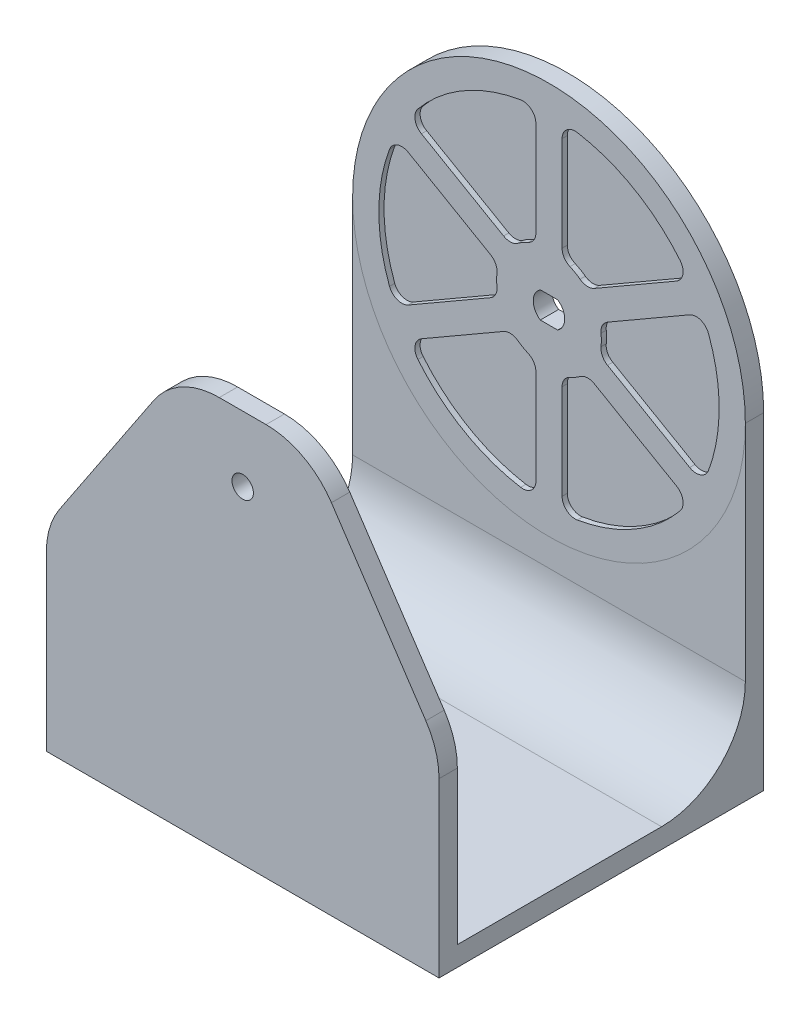
from build123d import *

# Parameters (mm, degrees)
SKETCH2_R           = 75
BOSS_EXTRUDE1_DEPTH = 3.5
CUT_EXTRUDE2_DEPTH  = 2
BOSS_EXTRUDE2_DEPTH = 7
SKETCH11_W          = 150
SKETCH11_H          = 7.544328289
BOSS_EXTRUDE4_DEPTH = 110
SKETCH12_W          = 150
SKETCH12_H          = 150.044328289
BOSS_EXTRUDE5_DEPTH = 7
SKETCH13_R          = 4.1
CUT_EXTRUDE3_DEPTH  = 7
FILLET1_R           = 32
CUT_EXTRUDE4_DEPTH  = 7
CUT_EXTRUDE5_DEPTH  = 7
FILLET2_R           = 30
FILLET3_R           = 30
FILLET4_R           = 30
FILLET5_R           = 30


with BuildPart() as part:
    # Sketch2 → Boss-Extrude1 (new, symmetric)
    with BuildSketch(Plane.XY):
        Circle(SKETCH2_R)
        with BuildLine():
            Line((-3.31662479, 5), (3.31662479, 5))
            ThreePointArc((3.31662479, 5), (6, 0), (3.31662479, -5))
            Line((3.31662479, -5), (-3.31662479, -5))
            ThreePointArc((-3.31662479, -5), (-6, 0), (-3.31662479, 5))
        make_face(mode=Mode.SUBTRACT)
    extrude(amount=BOSS_EXTRUDE1_DEPTH, both=True)

    # Sketch7 → Cut-Extrude2 (cut)
    with BuildSketch(Plane(origin=(0, 0, -3.5), x_dir=(-1, 0, 0), z_dir=(0, 0, -1))):
        with BuildLine():
            Line((-5, 59.160797831), (-5, 22.912878475))
            ThreePointArc((-5, 22.912878475), (-5.816699867, 20.174265687), (-8, 18.33030278))
            ThreePointArc((-8, 18.33030278), (-10, 17.320508076), (-11.874507866, 16.09335462))
            ThreePointArc((-11.874507866, 16.09335462), (-14.563076654, 15.124542695), (-17.343134833, 15.786566256))
            Line((-17.343134833, 15.786566256), (-48.73475383, 33.910525934))
            ThreePointArc((-48.73475383, 33.910525934), (-51.15568603, 37.354974521), (-50.087649982, 41.427374033))
            ThreePointArc((-50.087649982, 41.427374033), (-32.5, 56.291651246), (-10.833333333, 64.090864317))
            ThreePointArc((-10.833333333, 64.090864317), (-6.772513878, 62.97961091), (-5, 59.160797831))
        make_face()
        with BuildLine():
            Line((5, 59.160797831), (5, 22.912878475))
            ThreePointArc((5, 22.912878475), (5.816699867, 20.174265687), (8, 18.33030278))
            ThreePointArc((8, 18.33030278), (10, 17.320508076), (11.874507866, 16.09335462))
            ThreePointArc((11.874507866, 16.09335462), (14.563076654, 15.124542695), (17.343134833, 15.786566256))
            Line((17.343134833, 15.786566256), (48.73475383, 33.910525934))
            ThreePointArc((48.73475383, 33.910525934), (51.15568603, 37.354974521), (50.087649982, 41.427374033))
            ThreePointArc((50.087649982, 41.427374033), (32.5, 56.291651246), (10.833333333, 64.090864317))
            ThreePointArc((10.833333333, 64.090864317), (6.772513878, 62.97961091), (5, 59.160797831))
        make_face()
        with BuildLine():
            Line((53.73475383, 25.250271897), (22.343134833, 7.126312218))
            ThreePointArc((22.343134833, 7.126312218), (20.379776522, 5.049722992), (19.874507866, 2.23694816))
            ThreePointArc((19.874507866, 2.23694816), (20, 0), (19.874507866, -2.23694816))
            ThreePointArc((19.874507866, -2.23694816), (20.379776522, -5.049722992), (22.343134833, -7.126312218))
            Line((22.343134833, -7.126312218), (53.73475383, -25.250271897))
            ThreePointArc((53.73475383, -25.250271897), (57.928199908, -25.624636389), (60.920983316, -22.663490284))
            ThreePointArc((60.920983316, -22.663490284), (65, 0), (60.920983316, 22.663490284))
            ThreePointArc((60.920983316, 22.663490284), (57.928199908, 25.624636389), (53.73475383, 25.250271897))
        make_face()
        with BuildLine():
            Line((48.73475383, -33.910525934), (17.343134833, -15.786566256))
            ThreePointArc((17.343134833, -15.786566256), (14.563076654, -15.124542695), (11.874507866, -16.09335462))
            ThreePointArc((11.874507866, -16.09335462), (10, -17.320508076), (8, -18.33030278))
            ThreePointArc((8, -18.33030278), (5.816699867, -20.174265687), (5, -22.912878475))
            Line((5, -22.912878475), (5, -59.160797831))
            ThreePointArc((5, -59.160797831), (6.772513878, -62.97961091), (10.833333333, -64.090864317))
            ThreePointArc((10.833333333, -64.090864317), (32.5, -56.291651246), (50.087649982, -41.427374033))
            ThreePointArc((50.087649982, -41.427374033), (51.15568603, -37.354974521), (48.73475383, -33.910525934))
        make_face()
        with BuildLine():
            Line((-5, -59.160797831), (-5, -22.912878475))
            ThreePointArc((-5, -22.912878475), (-5.816699867, -20.174265687), (-8, -18.33030278))
            ThreePointArc((-8, -18.33030278), (-10, -17.320508076), (-11.874507866, -16.09335462))
            ThreePointArc((-11.874507866, -16.09335462), (-14.563076654, -15.124542695), (-17.343134833, -15.786566256))
            Line((-17.343134833, -15.786566256), (-48.73475383, -33.910525934))
            ThreePointArc((-48.73475383, -33.910525934), (-51.15568603, -37.354974521), (-50.087649982, -41.427374033))
            ThreePointArc((-50.087649982, -41.427374033), (-32.5, -56.291651246), (-10.833333333, -64.090864317))
            ThreePointArc((-10.833333333, -64.090864317), (-6.772513878, -62.97961091), (-5, -59.160797831))
        make_face()
        with BuildLine():
            Line((-53.73475383, -25.250271897), (-22.343134833, -7.126312218))
            ThreePointArc((-22.343134833, -7.126312218), (-20.379776522, -5.049722992), (-19.874507866, -2.23694816))
            ThreePointArc((-19.874507866, -2.23694816), (-20, 0), (-19.874507866, 2.23694816))
            ThreePointArc((-19.874507866, 2.23694816), (-20.379776522, 5.049722992), (-22.343134833, 7.126312218))
            Line((-22.343134833, 7.126312218), (-53.73475383, 25.250271897))
            ThreePointArc((-53.73475383, 25.250271897), (-57.928199908, 25.624636389), (-60.920983316, 22.663490284))
            ThreePointArc((-60.920983316, 22.663490284), (-65, 0), (-60.920983316, -22.663490284))
            ThreePointArc((-60.920983316, -22.663490284), (-57.928199908, -25.624636389), (-53.73475383, -25.250271897))
        make_face()
    cut_extrude2 = extrude(amount=-CUT_EXTRUDE2_DEPTH, mode=Mode.SUBTRACT)

    # Mirror1: Cut-Extrude2 across plane
    add(cut_extrude2.mirror(Plane.XY), mode=Mode.SUBTRACT)


with BuildPart() as body_2:
    # Sketch8 → Boss-Extrude2 (new body)
    with BuildSketch(Plane.XY.offset(3.5)):
        with BuildLine():
            ThreePointArc((75, 0), (0, -75), (-75, 0))
            Line((-75, 0), (-75, -125))
            Line((-75, -125), (75, -125))
            Line((75, -125), (75, 0))
        make_face()
    extrude(amount=-BOSS_EXTRUDE2_DEPTH)

    # Sketch11 → Boss-Extrude4 (add)
    with BuildSketch(Plane.XY.offset(3.5)):
        with Locations((0, -121.227835856)):
            Rectangle(SKETCH11_W, SKETCH11_H)
    extrude(amount=BOSS_EXTRUDE4_DEPTH)

    # Sketch12 → Boss-Extrude5 (add)
    with BuildSketch(Plane.XY.offset(113.5)):
        with Locations((0, -49.977835856)):
            Rectangle(SKETCH12_W, SKETCH12_H)
    extrude(amount=BOSS_EXTRUDE5_DEPTH)

    # Sketch13 → Cut-Extrude3 (cut)
    with BuildSketch(Plane.XY.offset(120.5)):
        Circle(SKETCH13_R)
    extrude(amount=-CUT_EXTRUDE3_DEPTH, mode=Mode.SUBTRACT)

    # Fillet1
    fillet1_edges = [body_2.edges().sort_by_distance(p)[0] for p in [
        (0, -117.455671711, 3.5),
    ]]
    fillet(fillet1_edges, radius=FILLET1_R)

    # Sketch14 → Cut-Extrude4 (cut)
    with BuildSketch(Plane.XY.offset(120.5)):
        Polygon((-75, -49.977835856), (-25, 25.044328289), (-75, 25.044328289), align=None)
    extrude(amount=-CUT_EXTRUDE4_DEPTH, mode=Mode.SUBTRACT)

    # Sketch16 → Cut-Extrude5 (cut)
    with BuildSketch(Plane.XY.offset(120.5)):
        Polygon((25, 25.044328289), (75, -49.977835856), (75, 25.044328289), align=None)
    extrude(amount=-CUT_EXTRUDE5_DEPTH, mode=Mode.SUBTRACT)

    # Fillet2
    fillet2_edges = [body_2.edges().sort_by_distance(p)[0] for p in [
        (-25, 25.044328289, 117),
    ]]
    fillet(fillet2_edges, radius=FILLET2_R)

    # Fillet3
    fillet3_edges = [body_2.edges().sort_by_distance(p)[0] for p in [
        (25, 25.044328289, 117),
    ]]
    fillet(fillet3_edges, radius=FILLET3_R)

    # Fillet4
    fillet4_edges = [body_2.edges().sort_by_distance(p)[0] for p in [
        (-75, -49.977835856, 117),
    ]]
    fillet(fillet4_edges, radius=FILLET4_R)

    # Fillet5
    fillet5_edges = [body_2.edges().sort_by_distance(p)[0] for p in [
        (75, -49.977835856, 117),
    ]]
    fillet(fillet5_edges, radius=FILLET5_R)


solid = Compound([part.part, body_2.part])
